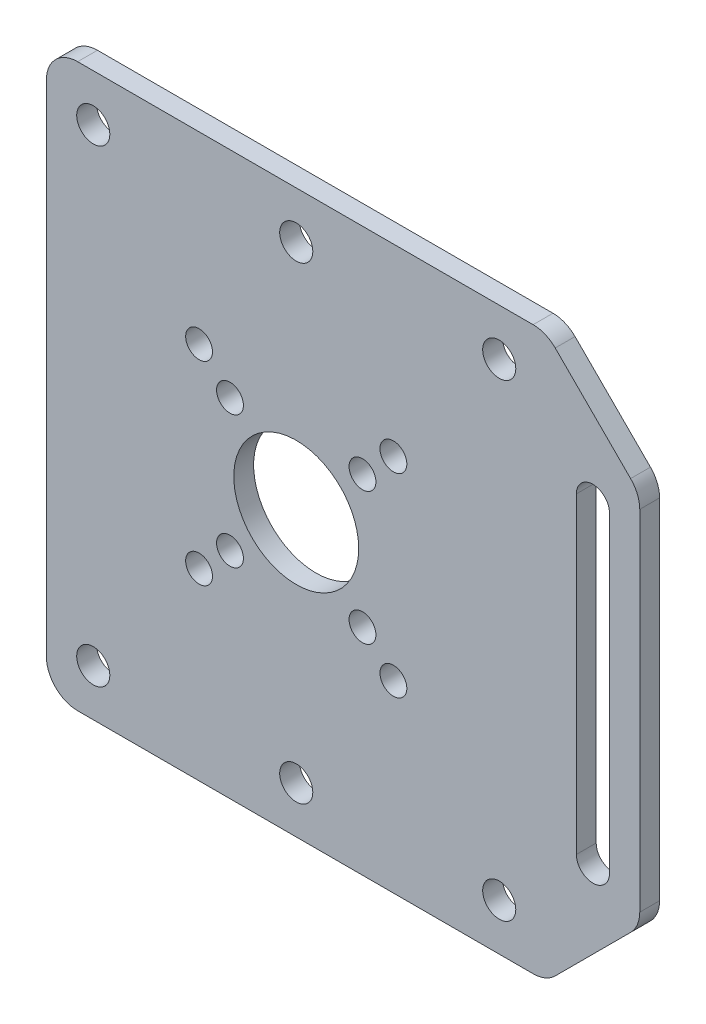
from build123d import *

# Parameters (mm, degrees)
SKETCH1_R            = 10
BASE_FLANGE1_DEPTH   = 3.175
M4_CLEARANCE_HOLE1_D = 4.3
M5_CLEARANCE_HOLE1_D = 5.3
FILLET1_R            = 5


# Sheet-metal steps are written as plain solids
with BuildPart() as part:
    # Sketch1 → Base-Flange1 (new body)
    with BuildSketch(Plane.XY):
        Polygon((40, 45), (55, 30), (55, -30), (40, -45), (-40, -45), (-40, 45), align=None)
        Circle(SKETCH1_R, mode=Mode.SUBTRACT)
        with BuildLine():
            Line((44.85, 25), (44.85, -25))
            ThreePointArc((44.85, -25), (47.5, -27.65), (50.15, -25))
            Line((50.15, -25), (50.15, 25))
            ThreePointArc((50.15, 25), (47.5, 27.65), (44.85, 25))
        make_face(mode=Mode.SUBTRACT)
    extrude(amount=-BASE_FLANGE1_DEPTH)

    # M4 Clearance Hole1 (through all)
    with Locations(Plane(origin=(-15.556349186, 15.556349186, 0), x_dir=(1, 0, 0), z_dir=(0, 0, 1))):
        with Locations((0, 0), (31.112698372, 0), (26.162950904, -4.949747468), (4.949747468, -4.949747468), (0, -31.112698372), (31.112698372, -31.112698372), (26.162950904, -26.162950904), (4.949747468, -26.162950904)):
            Hole(M4_CLEARANCE_HOLE1_D / 2)

    # M5 Clearance Hole1 (through all)
    with Locations(Plane(origin=(-32.5, 37.5, 0), x_dir=(1, 0, 0), z_dir=(0, 0, 1))):
        with Locations((0, 0), (65, 0), (65, -75), (0, -75), (32.5, 0), (32.5, -75)):
            Hole(M5_CLEARANCE_HOLE1_D / 2)

    # Fillet1
    fillet1_edges = [part.edges().sort_by_distance(p)[0] for p in [
        (-40, 45, -1.5875),
        (40, 45, -1.5875),
        (55, 30, -1.5875),
        (55, -30, -1.5875),
        (40, -45, -1.5875),
        (-40, -45, -1.5875),
    ]]
    fillet(fillet1_edges, radius=FILLET1_R)


solid = part.part
